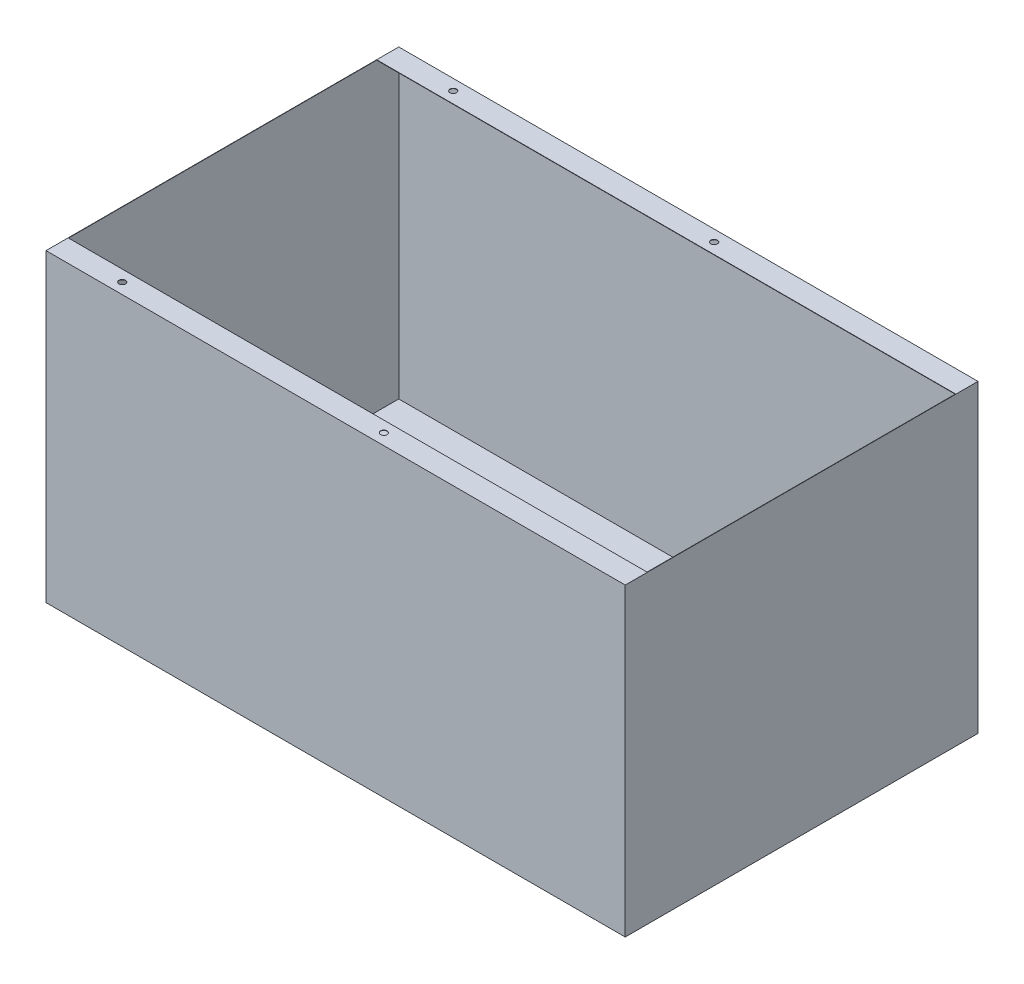
from build123d import *

# Parameters (mm, degrees)
SKETCH1_W           = 2057.4
SKETCH1_H           = 1778
BOSS_EXTRUDE1_DEPTH = 3378.2
SKETCH2_W           = 3374.19999784
SKETCH2_H           = 2053.39999784
CUT_EXTRUDE1_DEPTH  = 1775.99999892
SKETCH3_W           = 3374.19999784
SKETCH3_H           = 2.00000108
BOSS_EXTRUDE2_DEPTH = 127
SKETCH4_W           = 3374.19999784
SKETCH4_H           = 2.00000108
BOSS_EXTRUDE3_DEPTH = 127
CUT_EXTRUDE2_REACH  = 4338.636
SKETCH5_R           = 19.05


with BuildPart() as part:
    # Sketch1 → Boss-Extrude1 (new body)
    with BuildSketch(Plane(origin=(0, 0, 0), x_dir=(0, 0, -1), z_dir=(1, 0, 0))):
        with Locations((1028.7, 889)):
            Rectangle(SKETCH1_W, SKETCH1_H)
    extrude(amount=-BOSS_EXTRUDE1_DEPTH)

    # Sketch2 → Cut-Extrude1 (cut)
    with BuildSketch(Plane(origin=(0, 1778, 0), x_dir=(1, 0, 0), z_dir=(0, 1, 0))):
        with Locations((-1689.1, 1028.7)):
            Rectangle(SKETCH2_W, SKETCH2_H)
    extrude(amount=-CUT_EXTRUDE1_DEPTH, mode=Mode.SUBTRACT)

    # Sketch3 → Boss-Extrude2 (add)
    with BuildSketch(Plane.XY.offset(-2055.39999892)):
        with Locations((-1689.1, 1776.99999946)):
            Rectangle(SKETCH3_W, SKETCH3_H)
    extrude(amount=BOSS_EXTRUDE2_DEPTH)

    # Sketch4 → Boss-Extrude3 (add)
    with BuildSketch(Plane(origin=(0, 0, -2.00000108), x_dir=(-1, 0, 0), z_dir=(0, 0, -1))):
        with Locations((1689.1, 1776.99999946)):
            Rectangle(SKETCH4_W, SKETCH4_H)
    extrude(amount=BOSS_EXTRUDE3_DEPTH)

    # Sketch5 → Cut-Extrude2 (cut, up to next)
    with BuildSketch(Plane(origin=(0, 1778, 0), x_dir=(1, 0, 0), z_dir=(0, 1, 0)), mode=Mode.PRIVATE) as cut_extrude2_sk1:
        with Locations((-1473.2, 65.50000108)):
            Circle(SKETCH5_R)
    cut_extrude2_tool1 = extrude(cut_extrude2_sk1.sketch, amount=-CUT_EXTRUDE2_REACH, mode=Mode.PRIVATE) & part.part
    # Sketch5 → Cut-Extrude2 (cut, up to next)
    with BuildSketch(Plane(origin=(0, 1778, 0), x_dir=(1, 0, 0), z_dir=(0, 1, 0)), mode=Mode.PRIVATE) as cut_extrude2_sk2:
        with Locations((-1473.2, 1991.89999892)):
            Circle(SKETCH5_R)
    cut_extrude2_tool2 = extrude(cut_extrude2_sk2.sketch, amount=-CUT_EXTRUDE2_REACH, mode=Mode.PRIVATE) & part.part
    # Sketch5 → Cut-Extrude2 (cut, up to next)
    with BuildSketch(Plane(origin=(0, 1778, 0), x_dir=(1, 0, 0), z_dir=(0, 1, 0)), mode=Mode.PRIVATE) as cut_extrude2_sk3:
        with Locations((-2997.2, 1993.9)):
            Circle(SKETCH5_R)
    cut_extrude2_tool3 = extrude(cut_extrude2_sk3.sketch, amount=-CUT_EXTRUDE2_REACH, mode=Mode.PRIVATE) & part.part
    # Sketch5 → Cut-Extrude2 (cut, up to next)
    with BuildSketch(Plane(origin=(0, 1778, 0), x_dir=(1, 0, 0), z_dir=(0, 1, 0)), mode=Mode.PRIVATE) as cut_extrude2_sk4:
        with Locations((-2997.2, 63.5)):
            Circle(SKETCH5_R)
    cut_extrude2_tool4 = extrude(cut_extrude2_sk4.sketch, amount=-CUT_EXTRUDE2_REACH, mode=Mode.PRIVATE) & part.part
    add(cut_extrude2_tool1.solids().sort_by_distance((-1473.2, 1778, -65.500001))[0], mode=Mode.SUBTRACT)
    add(cut_extrude2_tool2.solids().sort_by_distance((-1473.2, 1778, -1991.899999))[0], mode=Mode.SUBTRACT)
    add(cut_extrude2_tool3.solids().sort_by_distance((-2997.2, 1778, -1993.9))[0], mode=Mode.SUBTRACT)
    add(cut_extrude2_tool4.solids().sort_by_distance((-2997.2, 1778, -63.5))[0], mode=Mode.SUBTRACT)


solid = part.part
